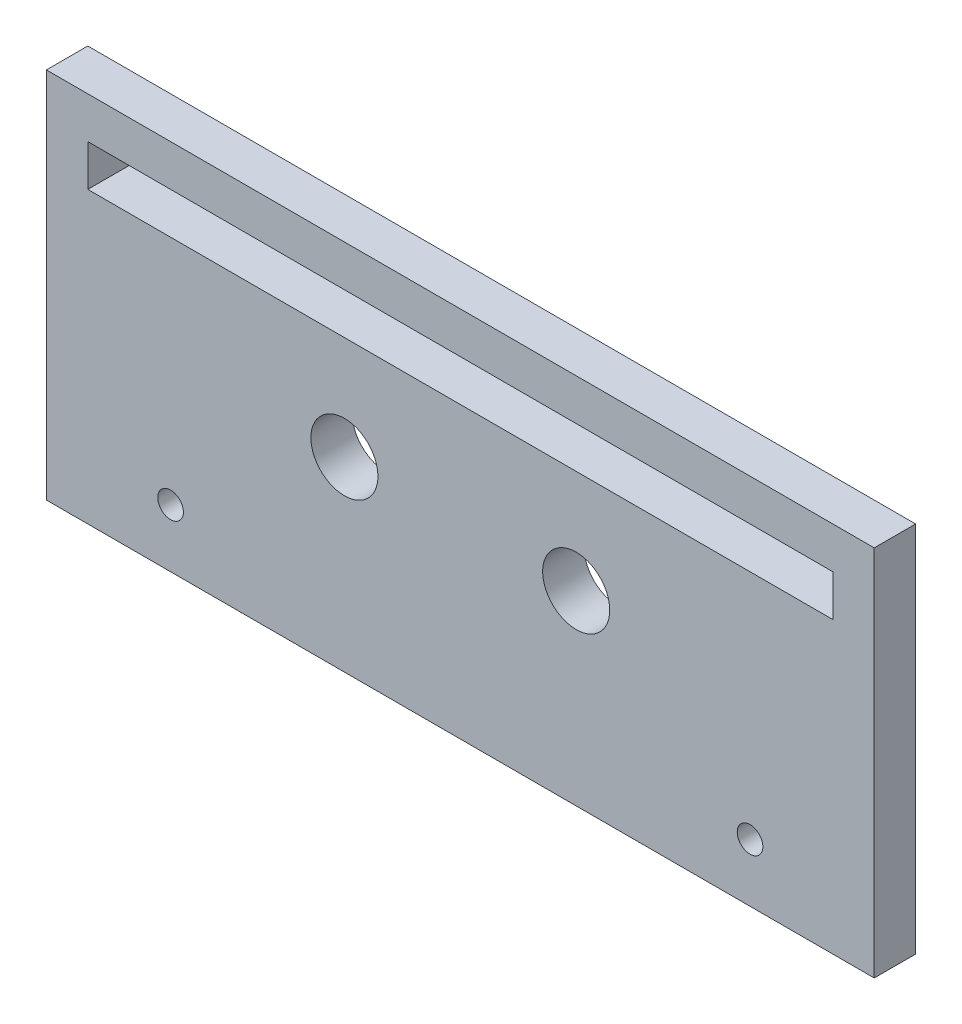
from build123d import *

# Parameters (mm, degrees)
ESQUISSE1_W        = 100
ESQUISSE1_H        = 45
ESQUISSE1_R        = 1.55
ESQUISSE1_R_2      = 4.05
ESQUISSE1_W_2      = 90
ESQUISSE1_H_2      = 5
BOSS_EXTRU_1_DEPTH = 5


with BuildPart() as part:
    # Esquisse1 → Boss.-Extru.1 (new body)
    with BuildSketch(Plane.XY):
        Rectangle(ESQUISSE1_W, ESQUISSE1_H)
        with Locations((-35, -15.5)):
            Circle(ESQUISSE1_R, mode=Mode.SUBTRACT)
        with Locations((35, -15.5)):
            Circle(ESQUISSE1_R, mode=Mode.SUBTRACT)
        with Locations((14, 0)):
            Circle(ESQUISSE1_R_2, mode=Mode.SUBTRACT)
        with Locations((-14, 0)):
            Circle(ESQUISSE1_R_2, mode=Mode.SUBTRACT)
        with Locations((0, 15)):
            Rectangle(ESQUISSE1_W_2, ESQUISSE1_H_2, mode=Mode.SUBTRACT)
    extrude(amount=-BOSS_EXTRU_1_DEPTH)


solid = part.part
